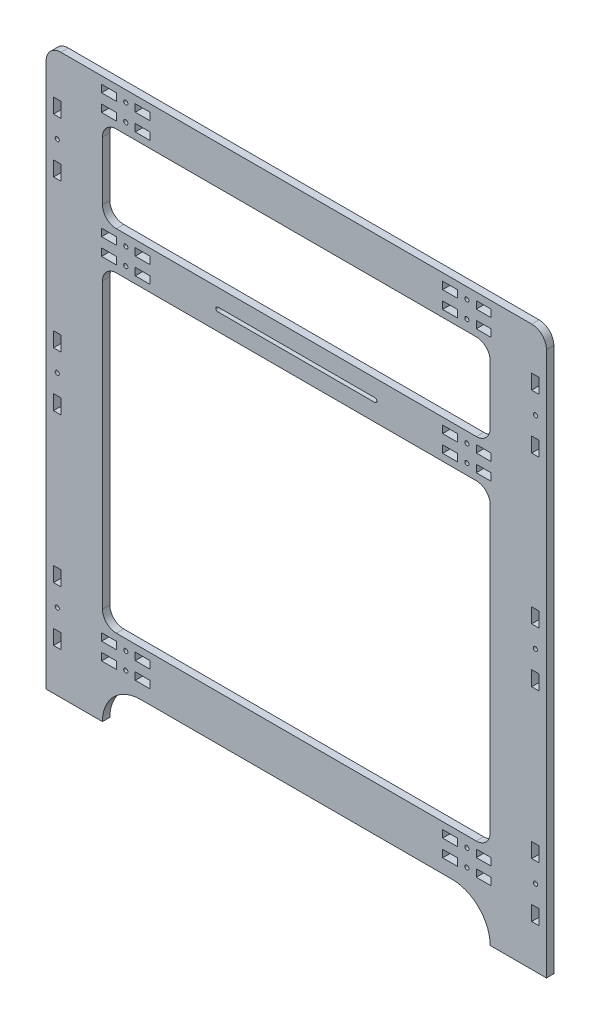
from build123d import *

# Parameters (mm, degrees)
SKETCH1_SIDE_SKETCH_2_W   = 5.333
SKETCH1_SIDE_SKETCH_2_H   = 10.666
SKETCH1_SIDE_SKETCH_2_W_2 = 10.666
SKETCH1_SIDE_SKETCH_2_H_2 = 5.333
SKETCH1_SIDE_SKETCH_2_R   = 1.5
BOSS_EXTRUDE1_DEPTH       = 5.333


with BuildPart() as part:
    # Sketch1-Side Sketch<2> → Boss-Extrude1 (new body)
    with BuildSketch(Plane.XY):
        with BuildLine():
            Line((170, 100.666), (-170, 100.666))
            ThreePointArc((-170, 100.666), (-177.542000928, 97.542000928), (-180.666, 90))
            Line((-180.666, 90), (-180.666, -303))
            Line((-180.666, -303), (-140, -303))
            ThreePointArc((-140, -303), (-131.896523315, -283.436476685), (-112.333, -275.333))
            Line((-112.333, -275.333), (112.333, -275.333))
            ThreePointArc((112.333, -275.333), (131.896523315, -283.436476685), (140, -303))
            Line((140, -303), (180.666, -303))
            Line((180.666, -303), (180.666, 90))
            ThreePointArc((180.666, 90), (177.542000928, 97.542000928), (170, 100.666))
        make_face()
        with Locations((172.6665, 64.667)):
            Rectangle(SKETCH1_SIDE_SKETCH_2_W, SKETCH1_SIDE_SKETCH_2_H, mode=Mode.SUBTRACT)
        with Locations((172.6665, 25.333)):
            Rectangle(SKETCH1_SIDE_SKETCH_2_W, SKETCH1_SIDE_SKETCH_2_H, mode=Mode.SUBTRACT)
        with Locations((172.6665, -81.5)):
            Rectangle(SKETCH1_SIDE_SKETCH_2_W, SKETCH1_SIDE_SKETCH_2_H, mode=Mode.SUBTRACT)
        with Locations((172.6665, -120.834)):
            Rectangle(SKETCH1_SIDE_SKETCH_2_W, SKETCH1_SIDE_SKETCH_2_H, mode=Mode.SUBTRACT)
        with Locations((172.6665, -228.333)):
            Rectangle(SKETCH1_SIDE_SKETCH_2_W, SKETCH1_SIDE_SKETCH_2_H, mode=Mode.SUBTRACT)
        with Locations((172.6665, -267.667)):
            Rectangle(SKETCH1_SIDE_SKETCH_2_W, SKETCH1_SIDE_SKETCH_2_H, mode=Mode.SUBTRACT)
        with Locations((-172.6665, -267.667)):
            Rectangle(SKETCH1_SIDE_SKETCH_2_W, SKETCH1_SIDE_SKETCH_2_H, mode=Mode.SUBTRACT)
        with Locations((-172.6665, -228.333)):
            Rectangle(SKETCH1_SIDE_SKETCH_2_W, SKETCH1_SIDE_SKETCH_2_H, mode=Mode.SUBTRACT)
        with Locations((-172.6665, -120.834)):
            Rectangle(SKETCH1_SIDE_SKETCH_2_W, SKETCH1_SIDE_SKETCH_2_H, mode=Mode.SUBTRACT)
        with Locations((-172.6665, -81.5)):
            Rectangle(SKETCH1_SIDE_SKETCH_2_W, SKETCH1_SIDE_SKETCH_2_H, mode=Mode.SUBTRACT)
        with Locations((-172.6665, 25.333)):
            Rectangle(SKETCH1_SIDE_SKETCH_2_W, SKETCH1_SIDE_SKETCH_2_H, mode=Mode.SUBTRACT)
        with Locations((-172.6665, 64.667)):
            Rectangle(SKETCH1_SIDE_SKETCH_2_W, SKETCH1_SIDE_SKETCH_2_H, mode=Mode.SUBTRACT)
        with Locations((-135.320282912, -262.6665)):
            Rectangle(SKETCH1_SIDE_SKETCH_2_W_2, SKETCH1_SIDE_SKETCH_2_H_2, mode=Mode.SUBTRACT)
        with Locations((-123.153282912, -262.6665)):
            Circle(SKETCH1_SIDE_SKETCH_2_R, mode=Mode.SUBTRACT)
        with Locations((-110.986282912, -262.6665)):
            Rectangle(SKETCH1_SIDE_SKETCH_2_W_2, SKETCH1_SIDE_SKETCH_2_H_2, mode=Mode.SUBTRACT)
        with Locations((-135.320282912, -250.3335)):
            Rectangle(SKETCH1_SIDE_SKETCH_2_W_2, SKETCH1_SIDE_SKETCH_2_H_2, mode=Mode.SUBTRACT)
        with Locations((-123.153282912, -250.3335)):
            Circle(SKETCH1_SIDE_SKETCH_2_R, mode=Mode.SUBTRACT)
        with Locations((-110.986282912, -250.3335)):
            Rectangle(SKETCH1_SIDE_SKETCH_2_W_2, SKETCH1_SIDE_SKETCH_2_H_2, mode=Mode.SUBTRACT)
        with Locations((110.986282912, -262.6665)):
            Rectangle(SKETCH1_SIDE_SKETCH_2_W_2, SKETCH1_SIDE_SKETCH_2_H_2, mode=Mode.SUBTRACT)
        with Locations((123.153282912, -262.6665)):
            Circle(SKETCH1_SIDE_SKETCH_2_R, mode=Mode.SUBTRACT)
        with Locations((135.320282912, -262.6665)):
            Rectangle(SKETCH1_SIDE_SKETCH_2_W_2, SKETCH1_SIDE_SKETCH_2_H_2, mode=Mode.SUBTRACT)
        with Locations((110.986282912, -250.3335)):
            Rectangle(SKETCH1_SIDE_SKETCH_2_W_2, SKETCH1_SIDE_SKETCH_2_H_2, mode=Mode.SUBTRACT)
        with Locations((123.153282912, -250.3335)):
            Circle(SKETCH1_SIDE_SKETCH_2_R, mode=Mode.SUBTRACT)
        with Locations((135.320282912, -250.3335)):
            Rectangle(SKETCH1_SIDE_SKETCH_2_W_2, SKETCH1_SIDE_SKETCH_2_H_2, mode=Mode.SUBTRACT)
        with BuildLine():
            Line((-130, -17.333), (130, -17.333))
            ThreePointArc((130, -17.333), (137.071067812, -20.261932188), (140, -27.333))
            Line((140, -27.333), (140, -232.667))
            ThreePointArc((140, -232.667), (137.071067812, -239.738067812), (130, -242.667))
            Line((130, -242.667), (-130, -242.667))
            ThreePointArc((-130, -242.667), (-137.071067812, -239.738067812), (-140, -232.667))
            Line((-140, -232.667), (-140, -27.333))
            ThreePointArc((-140, -27.333), (-137.071067812, -20.261932188), (-130, -17.333))
        make_face(mode=Mode.SUBTRACT)
        with Locations((-135.320282912, -9.6665)):
            Rectangle(SKETCH1_SIDE_SKETCH_2_W_2, SKETCH1_SIDE_SKETCH_2_H_2, mode=Mode.SUBTRACT)
        with Locations((-123.153282912, -9.6665)):
            Circle(SKETCH1_SIDE_SKETCH_2_R, mode=Mode.SUBTRACT)
        with Locations((-110.986282912, -9.6665)):
            Rectangle(SKETCH1_SIDE_SKETCH_2_W_2, SKETCH1_SIDE_SKETCH_2_H_2, mode=Mode.SUBTRACT)
        with BuildLine():
            ThreePointArc((-56.666666667, -5), (-58.166666667, -3.5), (-56.666666667, -2))
            Line((-56.666666667, -2), (56.666666667, -2))
            ThreePointArc((56.666666667, -2), (58.166666667, -3.5), (56.666666667, -5))
            Line((56.666666667, -5), (-56.666666667, -5))
        make_face(mode=Mode.SUBTRACT)
        with Locations((-135.320282912, 2.6665)):
            Rectangle(SKETCH1_SIDE_SKETCH_2_W_2, SKETCH1_SIDE_SKETCH_2_H_2, mode=Mode.SUBTRACT)
        with Locations((-123.153282912, 2.6665)):
            Circle(SKETCH1_SIDE_SKETCH_2_R, mode=Mode.SUBTRACT)
        with Locations((-110.986282912, 2.6665)):
            Rectangle(SKETCH1_SIDE_SKETCH_2_W_2, SKETCH1_SIDE_SKETCH_2_H_2, mode=Mode.SUBTRACT)
        with Locations((-135.320282912, 80.3335)):
            Rectangle(SKETCH1_SIDE_SKETCH_2_W_2, SKETCH1_SIDE_SKETCH_2_H_2, mode=Mode.SUBTRACT)
        with Locations((-123.153282912, 80.3335)):
            Circle(SKETCH1_SIDE_SKETCH_2_R, mode=Mode.SUBTRACT)
        with Locations((-135.320282912, 92.6665)):
            Rectangle(SKETCH1_SIDE_SKETCH_2_W_2, SKETCH1_SIDE_SKETCH_2_H_2, mode=Mode.SUBTRACT)
        with Locations((-123.153282912, 92.6665)):
            Circle(SKETCH1_SIDE_SKETCH_2_R, mode=Mode.SUBTRACT)
        with Locations((-110.986282912, 80.3335)):
            Rectangle(SKETCH1_SIDE_SKETCH_2_W_2, SKETCH1_SIDE_SKETCH_2_H_2, mode=Mode.SUBTRACT)
        with Locations((-110.986282912, 92.6665)):
            Rectangle(SKETCH1_SIDE_SKETCH_2_W_2, SKETCH1_SIDE_SKETCH_2_H_2, mode=Mode.SUBTRACT)
        with BuildLine():
            Line((-130, 72.667), (130, 72.667))
            ThreePointArc((130, 72.667), (137.071067812, 69.738067812), (140, 62.667))
            Line((140, 62.667), (140, 20.333))
            ThreePointArc((140, 20.333), (137.071067812, 13.261932188), (130, 10.333))
            Line((130, 10.333), (-130, 10.333))
            ThreePointArc((-130, 10.333), (-137.071067812, 13.261932188), (-140, 20.333))
            Line((-140, 20.333), (-140, 62.667))
            ThreePointArc((-140, 62.667), (-137.071067812, 69.738067812), (-130, 72.667))
        make_face(mode=Mode.SUBTRACT)
        with Locations((110.986282912, -9.6665)):
            Rectangle(SKETCH1_SIDE_SKETCH_2_W_2, SKETCH1_SIDE_SKETCH_2_H_2, mode=Mode.SUBTRACT)
        with Locations((123.153282912, -9.6665)):
            Circle(SKETCH1_SIDE_SKETCH_2_R, mode=Mode.SUBTRACT)
        with Locations((135.320282912, -9.6665)):
            Rectangle(SKETCH1_SIDE_SKETCH_2_W_2, SKETCH1_SIDE_SKETCH_2_H_2, mode=Mode.SUBTRACT)
        with Locations((110.986282912, 2.6665)):
            Rectangle(SKETCH1_SIDE_SKETCH_2_W_2, SKETCH1_SIDE_SKETCH_2_H_2, mode=Mode.SUBTRACT)
        with Locations((123.153282912, 2.6665)):
            Circle(SKETCH1_SIDE_SKETCH_2_R, mode=Mode.SUBTRACT)
        with Locations((135.320282912, 2.6665)):
            Rectangle(SKETCH1_SIDE_SKETCH_2_W_2, SKETCH1_SIDE_SKETCH_2_H_2, mode=Mode.SUBTRACT)
        with Locations((110.986282912, 80.3335)):
            Rectangle(SKETCH1_SIDE_SKETCH_2_W_2, SKETCH1_SIDE_SKETCH_2_H_2, mode=Mode.SUBTRACT)
        with Locations((110.986282912, 92.6665)):
            Rectangle(SKETCH1_SIDE_SKETCH_2_W_2, SKETCH1_SIDE_SKETCH_2_H_2, mode=Mode.SUBTRACT)
        with Locations((123.153282912, 80.3335)):
            Circle(SKETCH1_SIDE_SKETCH_2_R, mode=Mode.SUBTRACT)
        with Locations((135.320282912, 80.3335)):
            Rectangle(SKETCH1_SIDE_SKETCH_2_W_2, SKETCH1_SIDE_SKETCH_2_H_2, mode=Mode.SUBTRACT)
        with Locations((123.153282912, 92.6665)):
            Circle(SKETCH1_SIDE_SKETCH_2_R, mode=Mode.SUBTRACT)
        with Locations((135.320282912, 92.6665)):
            Rectangle(SKETCH1_SIDE_SKETCH_2_W_2, SKETCH1_SIDE_SKETCH_2_H_2, mode=Mode.SUBTRACT)
        with Locations((172.6665, -101.167)):
            Circle(SKETCH1_SIDE_SKETCH_2_R, mode=Mode.SUBTRACT)
        with Locations((172.6665, 45)):
            Circle(SKETCH1_SIDE_SKETCH_2_R, mode=Mode.SUBTRACT)
        with Locations((172.6665, -248)):
            Circle(SKETCH1_SIDE_SKETCH_2_R, mode=Mode.SUBTRACT)
        with Locations((-172.6665, -248)):
            Circle(SKETCH1_SIDE_SKETCH_2_R, mode=Mode.SUBTRACT)
        with Locations((-172.6665, -101.167)):
            Circle(SKETCH1_SIDE_SKETCH_2_R, mode=Mode.SUBTRACT)
        with Locations((-172.6665, 45)):
            Circle(SKETCH1_SIDE_SKETCH_2_R, mode=Mode.SUBTRACT)
    extrude(amount=BOSS_EXTRUDE1_DEPTH)


solid = part.part
